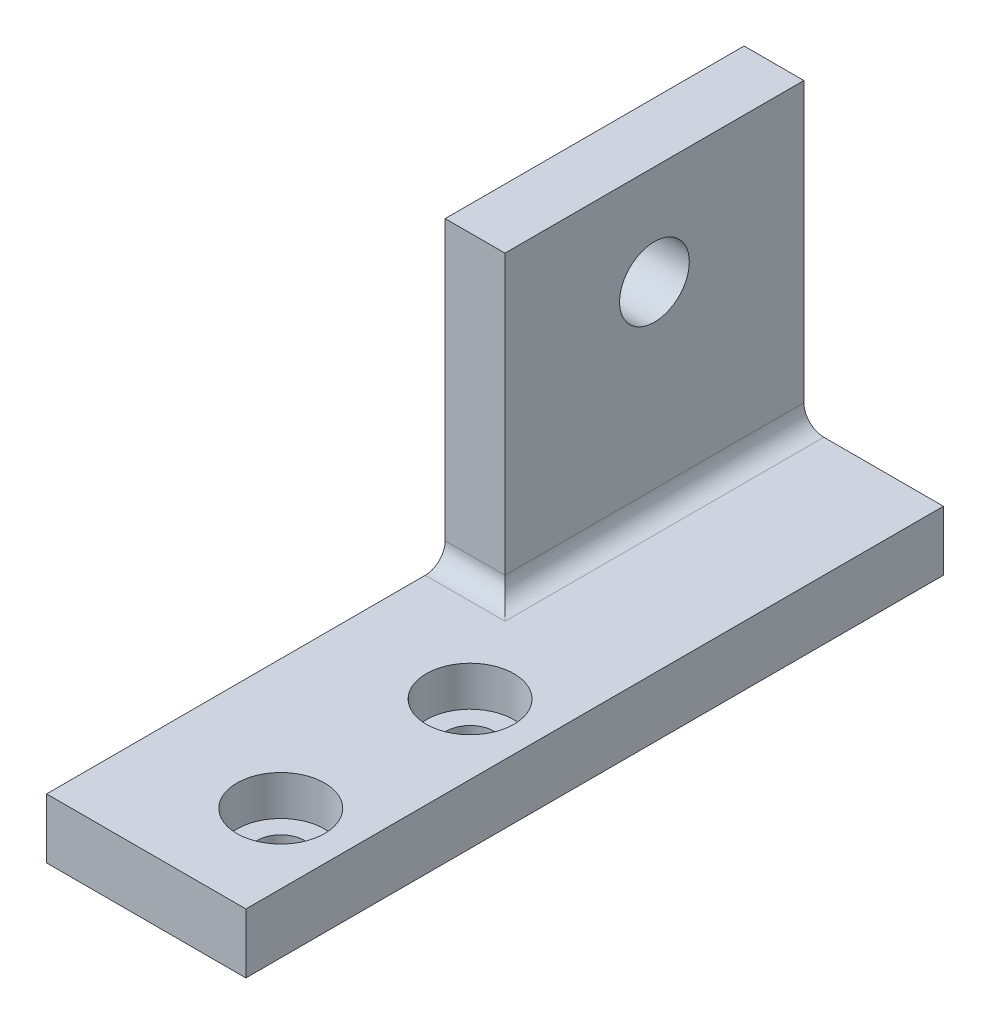
from build123d import *

# Parameters (mm, degrees)
SKETCH1_W                      = 10
SKETCH1_H                      = 20
SKETCH1_R                      = 1.175
BOSS_EXTRUDE1_DEPTH            = 3
CBORE_FOR_M2_SHCS1_D           = 2.4
CBORE_FOR_M2_SHCS1_CBORE_D     = 4.4
CBORE_FOR_M2_SHCS1_CBORE_DEPTH = 2
SKETCH6_W                      = 10
SKETCH6_H                      = 3
BOSS_EXTRUDE2_DEPTH            = 15
SKETCH8_W                      = 3
SKETCH8_H                      = 15
BOSS_EXTRUDE3_DEPTH            = 15
SKETCH9_R                      = 1.75
CUT_EXTRUDE1_DEPTH             = 40.974992183
FILLET1_R                      = 1


with BuildPart() as part:
    # Sketch1 → Boss-Extrude1 (new body)
    with BuildSketch(Plane(origin=(0, 0, 0), x_dir=(1, 0, 0), z_dir=(0, 1, 0))):
        with Locations((5, 10)):
            Rectangle(SKETCH1_W, SKETCH1_H)
        with Locations((6.5, 5.25)):
            Circle(SKETCH1_R, mode=Mode.SUBTRACT)
        with Locations((6.5, 14.75)):
            Circle(SKETCH1_R, mode=Mode.SUBTRACT)
    extrude(amount=BOSS_EXTRUDE1_DEPTH)

    # CBORE for M2 SHCS1 (through all)
    with Locations(Plane(origin=(0, 3, 0), x_dir=(1, 0, 0), z_dir=(0, 1, 0))):
        with Locations((6.5, 14.75), (6.5, 5.25)):
            CounterBoreHole(CBORE_FOR_M2_SHCS1_D / 2, CBORE_FOR_M2_SHCS1_CBORE_D / 2, CBORE_FOR_M2_SHCS1_CBORE_DEPTH)

    # Sketch6 → Boss-Extrude2 (add)
    with BuildSketch(Plane(origin=(0, 0, -20), x_dir=(-1, 0, 0), z_dir=(0, 0, -1))):
        with Locations((-5, 1.5)):
            Rectangle(SKETCH6_W, SKETCH6_H)
    extrude(amount=BOSS_EXTRUDE2_DEPTH)

    # Sketch8 → Boss-Extrude3 (add)
    with BuildSketch(Plane(origin=(0, 3, 0), x_dir=(1, 0, 0), z_dir=(0, 1, 0))):
        with Locations((1.5, 27.5)):
            Rectangle(SKETCH8_W, SKETCH8_H)
    extrude(amount=BOSS_EXTRUDE3_DEPTH)

    # Sketch9 → Cut-Extrude1 (cut, through all)
    with BuildSketch(Plane(origin=(3, 0, 0), x_dir=(0, 0, -1), z_dir=(1, 0, 0))):
        with Locations((27.5, 13)):
            Circle(SKETCH9_R)
    extrude(amount=-CUT_EXTRUDE1_DEPTH, mode=Mode.SUBTRACT)

    # Fillet1
    fillet1_edges = [part.edges().sort_by_distance(p)[0] for p in [
        (1.5, 3, -20),
        (3, 3, -27.5),
    ]]
    fillet(fillet1_edges, radius=FILLET1_R)


solid = part.part
